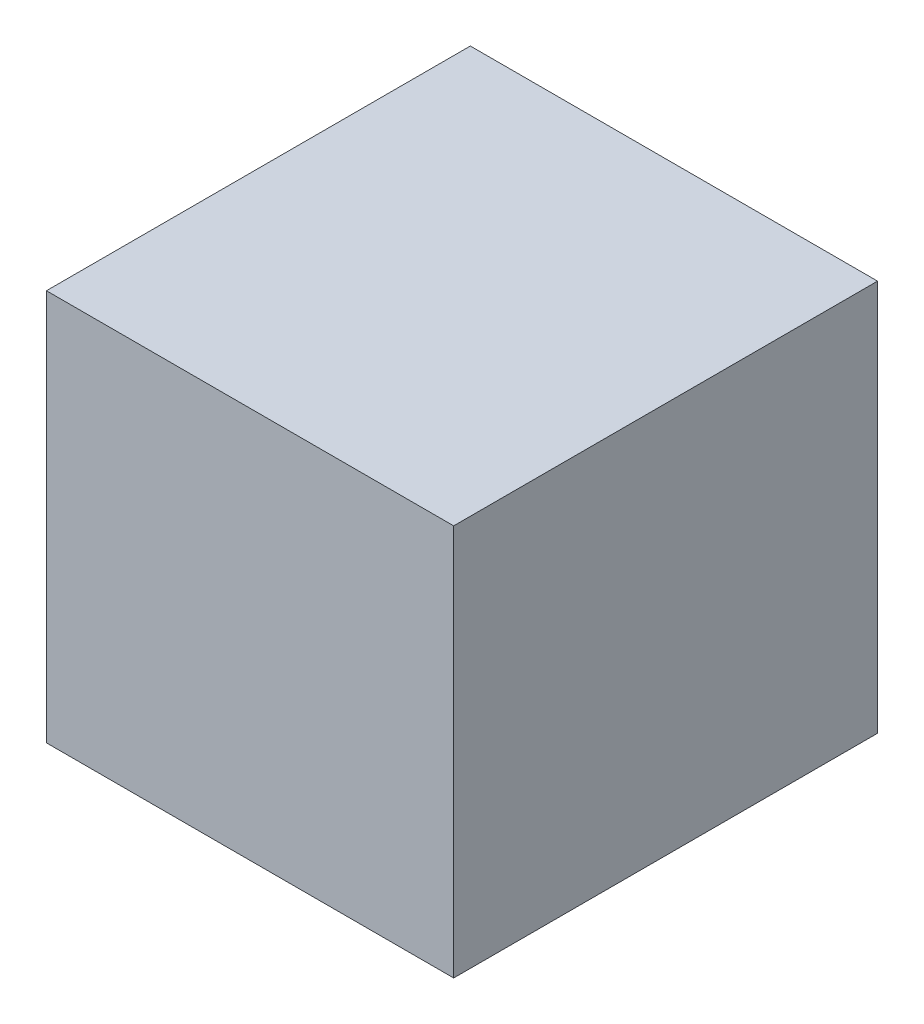
from build123d import *

# Parameters (mm, degrees)
SKETCH1_W           = 31.704484081
SKETCH1_H           = 30.485080847
BOSS_EXTRUDE1_DEPTH = 33


with BuildPart() as part:
    # Sketch1 → Boss-Extrude1 (new body)
    with BuildSketch(Plane.XY):
        with Locations((15.852242041, 15.242540424)):
            Rectangle(SKETCH1_W, SKETCH1_H)
    extrude(amount=BOSS_EXTRUDE1_DEPTH)


solid = part.part
